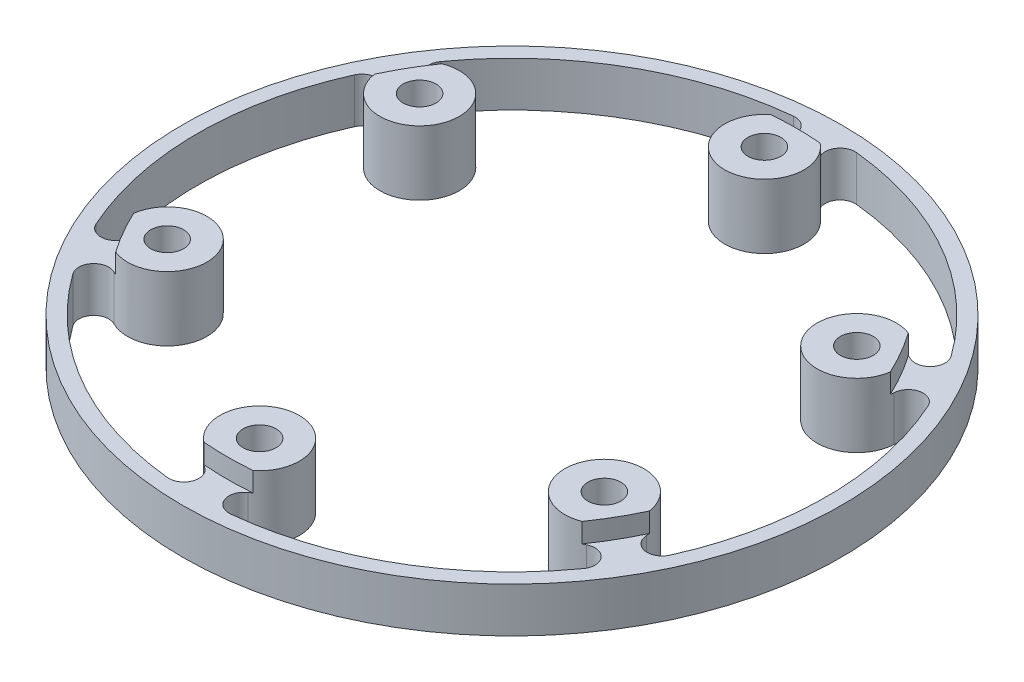
from build123d import *

# Parameters (mm, degrees)
SKETCH1_R             = 22
BASE_SHAPE_DEPTH      = 4.3
BASE_CUT_REACH        = 33.408
SKETCH4_R             = 2
MILLING_FILLETS_R     = 1
MIDDLE_START          = -1.3
SKETCH5_R             = 22
SKETCH5_R_2           = 19
MIDDLE_SLOT_CUT_DEPTH = 1.3
M2_SCREW_HOLES_REACH  = 33.408
SKETCH6_R             = 1.1
REMOVE_INNER_REACH    = 33.408


with BuildPart() as part:
    # Sketch1 → Base shape (new body)
    with BuildSketch(Plane(origin=(0, 0, 0), x_dir=(1, 0, 0), z_dir=(0, 1, 0))):
        Circle(SKETCH1_R)
    extrude(amount=BASE_SHAPE_DEPTH)

    # Sketch4 → Base cut (cut, up to next)
    with BuildSketch(Plane(origin=(0, 4.3, 0), x_dir=(1, 0, 0), z_dir=(0, 1, 0)), mode=Mode.PRIVATE) as base_cut_sk1:
        with BuildLine():
            Line((-0.5, 4.623040125), (-0.5, 14.247597264))
            ThreePointArc((-0.5, 14.247597264), (-2.599217903, 16.333699419), (-1.456663106, 19.063737246))
            ThreePointArc((-1.456663106, 19.063737246), (-1.064005646, 20.23376217), (-2.106664753, 20.894065273))
            ThreePointArc((-2.106664753, 20.894065273), (-10.500000081, 18.186533433), (-17.041459047, 12.271457678))
            ThreePointArc((-17.041459047, 12.271457678), (-16.990949169, 11.038336932), (-15.781349192, 10.793375879))
            ThreePointArc((-15.781349192, 10.793375879), (-12.845789682, 10.417838443), (-12.088781174, 7.556811334))
            Line((-12.088781174, 7.556811334), (-3.753670191, 2.744532765))
            ThreePointArc((-3.753670191, 2.744532765), (-2.325, 4.027018128), (-0.5, 4.623040125))
        make_face()
    base_cut_tool1 = extrude(base_cut_sk1.sketch, amount=-BASE_CUT_REACH, mode=Mode.PRIVATE) & part.part
    # Sketch4 → Base cut (cut, up to next)
    with BuildSketch(Plane(origin=(0, 4.3, 0), x_dir=(1, 0, 0), z_dir=(0, 1, 0)), mode=Mode.PRIVATE) as base_cut_sk2:
        with BuildLine():
            Line((0.5, 14.247597264), (0.5, 4.623040125))
            ThreePointArc((0.5, 4.623040125), (2.325, 4.027018128), (3.753670191, 2.744532765))
            Line((3.753670191, 2.744532765), (12.088781174, 7.556811334))
            ThreePointArc((12.088781174, 7.556811334), (12.845789714, 10.417838471), (15.781349267, 10.793375841))
            ThreePointArc((15.781349267, 10.793375841), (16.990949176, 11.03833694), (17.041459084, 12.271457627))
            ThreePointArc((17.041459084, 12.271457627), (10.500000121, 18.186533409), (2.106664783, 20.89406527))
            ThreePointArc((2.106664783, 20.89406527), (1.064005647, 20.233762173), (1.456663125, 19.063737234))
            ThreePointArc((1.456663125, 19.063737234), (2.599217901, 16.333699407), (0.5, 14.247597264))
        make_face()
    base_cut_tool2 = extrude(base_cut_sk2.sketch, amount=-BASE_CUT_REACH, mode=Mode.PRIVATE) & part.part
    # Sketch4 → Base cut (cut, up to next)
    with BuildSketch(Plane(origin=(0, 4.3, 0), x_dir=(1, 0, 0), z_dir=(0, 1, 0)), mode=Mode.PRIVATE) as base_cut_sk3:
        with BuildLine():
            ThreePointArc((-4.253670191, -1.878507361), (-4.65, 0), (-4.253670191, 1.878507361))
            Line((-4.253670191, 1.878507361), (-12.588781174, 6.69078593))
            ThreePointArc((-12.588781174, 6.69078593), (-15.445007591, 5.915860977), (-17.2380123, 8.27036138))
            ThreePointArc((-17.2380123, 8.27036138), (-18.054954849, 9.19542516), (-19.148123664, 8.622607504))
            ThreePointArc((-19.148123664, 8.622607504), (-21, 0), (-19.148123664, -8.622607504))
            ThreePointArc((-19.148123664, -8.622607504), (-18.054954849, -9.19542516), (-17.2380123, -8.27036138))
            ThreePointArc((-17.2380123, -8.27036138), (-15.445007591, -5.915860977), (-12.588781174, -6.69078593))
            Line((-12.588781174, -6.69078593), (-4.253670191, -1.878507361))
        make_face()
    base_cut_tool3 = extrude(base_cut_sk3.sketch, amount=-BASE_CUT_REACH, mode=Mode.PRIVATE) & part.part
    # Sketch4 → Base cut (cut, up to next)
    with BuildSketch(Plane(origin=(0, 4.3, 0), x_dir=(1, 0, 0), z_dir=(0, 1, 0)), mode=Mode.PRIVATE) as base_cut_sk4:
        with BuildLine():
            Line((12.588781174, 6.69078593), (4.253670191, 1.878507361))
            ThreePointArc((4.253670191, 1.878507361), (4.65, 0), (4.253670191, -1.878507361))
            Line((4.253670191, -1.878507361), (12.588781174, -6.69078593))
            ThreePointArc((12.588781174, -6.69078593), (15.44500764, -5.915860993), (17.238012306, -8.270361482))
            ThreePointArc((17.238012306, -8.270361482), (18.054954899, -9.19542517), (19.148123664, -8.622607504))
            ThreePointArc((19.148123664, -8.622607504), (21, -5.9e-08), (19.148123712, 8.622607396))
            ThreePointArc((19.148123712, 8.622607396), (18.054954907, 9.195425171), (17.2380123, 8.27036138))
            ThreePointArc((17.2380123, 8.27036138), (15.445007591, 5.915860977), (12.588781174, 6.69078593))
        make_face()
    base_cut_tool4 = extrude(base_cut_sk4.sketch, amount=-BASE_CUT_REACH, mode=Mode.PRIVATE) & part.part
    # Sketch4 → Base cut (cut, up to next)
    with BuildSketch(Plane(origin=(0, 4.3, 0), x_dir=(1, 0, 0), z_dir=(0, 1, 0)), mode=Mode.PRIVATE) as base_cut_sk5:
        with BuildLine():
            ThreePointArc((-0.5, -4.623040125), (-2.325, -4.027018128), (-3.753670191, -2.744532765))
            Line((-3.753670191, -2.744532765), (-12.088781174, -7.556811334))
            ThreePointArc((-12.088781174, -7.556811334), (-12.845789662, -10.417838426), (-15.781349145, -10.793375902))
            ThreePointArc((-15.781349145, -10.793375902), (-16.99094917, -11.038336934), (-17.041459014, -12.271457724))
            ThreePointArc((-17.041459014, -12.271457724), (-10.500000007, -18.186533475), (-2.10666464, -20.894065284))
            ThreePointArc((-2.10666464, -20.894065284), (-1.064005631, -20.233762127), (-1.456663086, -19.063737259))
            ThreePointArc((-1.456663086, -19.063737259), (-2.599217906, -16.33369943), (-0.5, -14.247597264))
            Line((-0.5, -14.247597264), (-0.5, -4.623040125))
        make_face()
    base_cut_tool5 = extrude(base_cut_sk5.sketch, amount=-BASE_CUT_REACH, mode=Mode.PRIVATE) & part.part
    # Sketch4 → Base cut (cut, up to next)
    with BuildSketch(Plane(origin=(0, 4.3, 0), x_dir=(1, 0, 0), z_dir=(0, 1, 0)), mode=Mode.PRIVATE) as base_cut_sk6:
        with BuildLine():
            Line((12.088781174, -7.556811334), (3.753670191, -2.744532765))
            ThreePointArc((3.753670191, -2.744532765), (2.325, -4.027018128), (0.5, -4.623040125))
            Line((0.5, -4.623040125), (0.5, -14.247597264))
            ThreePointArc((0.5, -14.247597264), (2.599217906, -16.33369943), (1.456663086, -19.063737259))
            ThreePointArc((1.456663086, -19.063737259), (1.064005629, -20.23376212), (2.106664626, -20.894065285))
            ThreePointArc((2.106664626, -20.894065285), (10.500000013, -18.186533472), (17.04145903, -12.271457701))
            ThreePointArc((17.04145903, -12.271457701), (16.990949199, -11.038336967), (15.781349249, -10.79337585))
            ThreePointArc((15.781349249, -10.79337585), (12.845789706, -10.417838464), (12.088781174, -7.556811334))
        make_face()
    base_cut_tool6 = extrude(base_cut_sk6.sketch, amount=-BASE_CUT_REACH, mode=Mode.PRIVATE) & part.part
    # Sketch4 → Base cut (cut, up to next)
    with BuildSketch(Plane(origin=(0, 4.3, 0), x_dir=(1, 0, 0), z_dir=(0, 1, 0)), mode=Mode.PRIVATE) as base_cut_sk7:
        Circle(SKETCH4_R)
    base_cut_tool7 = extrude(base_cut_sk7.sketch, amount=-BASE_CUT_REACH, mode=Mode.PRIVATE) & part.part
    add(base_cut_tool1.solids().sort_by_distance((-6.983603, 4.3, -12.095955))[0], mode=Mode.SUBTRACT)
    add(base_cut_tool2.solids().sort_by_distance((6.983603, 4.3, -12.095955))[0], mode=Mode.SUBTRACT)
    add(base_cut_tool3.solids().sort_by_distance((-13.967206, 4.3, 0))[0], mode=Mode.SUBTRACT)
    add(base_cut_tool4.solids().sort_by_distance((13.967206, 4.3, 0))[0], mode=Mode.SUBTRACT)
    add(base_cut_tool5.solids().sort_by_distance((-6.983603, 4.3, 12.095955))[0], mode=Mode.SUBTRACT)
    add(base_cut_tool6.solids().sort_by_distance((6.983603, 4.3, 12.095955))[0], mode=Mode.SUBTRACT)
    add(base_cut_tool7.solids().sort_by_distance((0, 4.3, 0))[0], mode=Mode.SUBTRACT)

    # Milling fillets
    milling_fillets_edges = [part.edges().sort_by_distance(p)[0] for p in [
        (12.088781174, 2.15, 7.556811334),
        (0.5, 2.15, 4.623040125),
        (12.588781174, 2.15, -6.69078593),
        (-0.5, 2.15, -4.623040125),
        (12.088781174, 2.15, -7.556811334),
        (0.5, 2.15, -4.623040125),
        (4.253670191, 2.15, 1.878507361),
        (0.5, 2.15, -14.247597264),
        (-12.088781174, 2.15, 7.556811334),
        (0.5, 2.15, 14.247597264),
        (3.753670191, 2.15, 2.744532765),
        (-0.5, 2.15, 4.623040125),
        (-0.5, 2.15, -14.247597264),
        (-0.5, 2.15, 14.247597264),
        (12.588781174, 2.15, 6.69078593),
        (3.753670191, 2.15, -2.744532765),
        (-4.253670191, 2.15, 1.878507361),
        (-12.588781174, 2.15, 6.69078593),
        (-3.753670191, 2.15, -2.744532765),
        (-12.088781174, 2.15, -7.556811334),
        (-12.588781174, 2.15, -6.69078593),
        (-4.253670191, 2.15, -1.878507361),
        (4.253670191, 2.15, -1.878507361),
        (-3.753670191, 2.15, 2.744532765),
    ]]
    fillet(milling_fillets_edges, radius=MILLING_FILLETS_R)

    # Sketch5 → Middle slot cut (cut)
    with BuildSketch(Plane(origin=(0, 4.3, 0), x_dir=(1, 0, 0), z_dir=(0, 1, 0)).offset(MIDDLE_START)):
        Circle(SKETCH5_R)
        Circle(SKETCH5_R_2, mode=Mode.SUBTRACT)
    extrude(amount=MIDDLE_SLOT_CUT_DEPTH, mode=Mode.SUBTRACT)

    # Sketch6 → M2 screw holes (cut, up to next)
    with BuildSketch(Plane(origin=(0, 4.3, 0), x_dir=(1, 0, 0), z_dir=(0, 1, 0)), mode=Mode.PRIVATE) as m2_screw_holes_sk1:
        with Locations((0, 16.85)):
            Circle(SKETCH6_R)
    m2_screw_holes_tool1 = extrude(m2_screw_holes_sk1.sketch, amount=-M2_SCREW_HOLES_REACH, mode=Mode.PRIVATE) & part.part
    # Sketch6 → M2 screw holes (cut, up to next)
    with BuildSketch(Plane(origin=(0, 4.3, 0), x_dir=(1, 0, 0), z_dir=(0, 1, 0)), mode=Mode.PRIVATE) as m2_screw_holes_sk2:
        with Locations((14.592528054, 8.425)):
            Circle(SKETCH6_R)
    m2_screw_holes_tool2 = extrude(m2_screw_holes_sk2.sketch, amount=-M2_SCREW_HOLES_REACH, mode=Mode.PRIVATE) & part.part
    # Sketch6 → M2 screw holes (cut, up to next)
    with BuildSketch(Plane(origin=(0, 4.3, 0), x_dir=(1, 0, 0), z_dir=(0, 1, 0)), mode=Mode.PRIVATE) as m2_screw_holes_sk3:
        with Locations((14.592528054, -8.425)):
            Circle(SKETCH6_R)
    m2_screw_holes_tool3 = extrude(m2_screw_holes_sk3.sketch, amount=-M2_SCREW_HOLES_REACH, mode=Mode.PRIVATE) & part.part
    # Sketch6 → M2 screw holes (cut, up to next)
    with BuildSketch(Plane(origin=(0, 4.3, 0), x_dir=(1, 0, 0), z_dir=(0, 1, 0)), mode=Mode.PRIVATE) as m2_screw_holes_sk4:
        with Locations((0, -16.85)):
            Circle(SKETCH6_R)
    m2_screw_holes_tool4 = extrude(m2_screw_holes_sk4.sketch, amount=-M2_SCREW_HOLES_REACH, mode=Mode.PRIVATE) & part.part
    # Sketch6 → M2 screw holes (cut, up to next)
    with BuildSketch(Plane(origin=(0, 4.3, 0), x_dir=(1, 0, 0), z_dir=(0, 1, 0)), mode=Mode.PRIVATE) as m2_screw_holes_sk5:
        with Locations((-14.592528054, -8.425)):
            Circle(SKETCH6_R)
    m2_screw_holes_tool5 = extrude(m2_screw_holes_sk5.sketch, amount=-M2_SCREW_HOLES_REACH, mode=Mode.PRIVATE) & part.part
    # Sketch6 → M2 screw holes (cut, up to next)
    with BuildSketch(Plane(origin=(0, 4.3, 0), x_dir=(1, 0, 0), z_dir=(0, 1, 0)), mode=Mode.PRIVATE) as m2_screw_holes_sk6:
        with Locations((-14.592528054, 8.425)):
            Circle(SKETCH6_R)
    m2_screw_holes_tool6 = extrude(m2_screw_holes_sk6.sketch, amount=-M2_SCREW_HOLES_REACH, mode=Mode.PRIVATE) & part.part
    add(m2_screw_holes_tool1.solids().sort_by_distance((0, 4.3, -16.85))[0], mode=Mode.SUBTRACT)
    add(m2_screw_holes_tool2.solids().sort_by_distance((14.592528, 4.3, -8.425))[0], mode=Mode.SUBTRACT)
    add(m2_screw_holes_tool3.solids().sort_by_distance((14.592528, 4.3, 8.425))[0], mode=Mode.SUBTRACT)
    add(m2_screw_holes_tool4.solids().sort_by_distance((0, 4.3, 16.85))[0], mode=Mode.SUBTRACT)
    add(m2_screw_holes_tool5.solids().sort_by_distance((-14.592528, 4.3, 8.425))[0], mode=Mode.SUBTRACT)
    add(m2_screw_holes_tool6.solids().sort_by_distance((-14.592528, 4.3, -8.425))[0], mode=Mode.SUBTRACT)

    # Sketch9 → Remove inner (cut, up to next)
    with BuildSketch(Plane(origin=(0, 4.3, 0), x_dir=(1, 0, 0), z_dir=(0, 1, 0)), mode=Mode.PRIVATE) as remove_inner_sk1:
        with BuildLine():
            ThreePointArc((13.044832762, -6.273921367), (12.510822481, -6.460941513), (11.960796803, -6.328218985))
            Line((11.960796803, -6.328218985), (4.967454292, -2.290610804))
            ThreePointArc((4.967454292, -2.290610804), (4.544902316, -1.810458242), (4.499763267, -1.172446391))
            ThreePointArc((4.499763267, -1.172446391), (4.65, 0), (4.499763267, 1.172446391))
            ThreePointArc((4.499763267, 1.172446391), (4.544902316, 1.810458242), (4.967454292, 2.290610804))
            Line((4.967454292, 2.290610804), (11.960796803, 6.328218985))
            ThreePointArc((11.960796803, 6.328218985), (12.510822481, 6.460941513), (13.044832762, 6.273921367))
            ThreePointArc((13.044832762, 6.273921367), (12.297560734, 7.1), (11.955791666, 8.160195877))
            ThreePointArc((11.955791666, 8.160195877), (11.850750723, 7.604219334), (11.460796803, 7.194244389))
            Line((11.460796803, 7.194244389), (4.467454292, 3.156636207))
            ThreePointArc((4.467454292, 3.156636207), (3.840353988, 3.030771742), (3.265249993, 3.310686105))
            ThreePointArc((3.265249993, 3.310686105), (2.325, 4.027018128), (1.234513274, 4.483132496))
            ThreePointArc((1.234513274, 4.483132496), (0.704548328, 4.841229984), (0.5, 5.447247011))
            Line((0.5, 5.447247011), (0.5, 13.522463374))
            ThreePointArc((0.5, 13.522463374), (0.660071758, 14.065160847), (1.089041096, 14.434117244))
            ThreePointArc((1.089041096, 14.434117244), (0, 14.2), (-1.089041096, 14.434117244))
            ThreePointArc((-1.089041096, 14.434117244), (-0.660071758, 14.065160847), (-0.5, 13.522463374))
            Line((-0.5, 13.522463374), (-0.5, 5.447247011))
            ThreePointArc((-0.5, 5.447247011), (-0.704548328, 4.841229984), (-1.234513274, 4.483132496))
            ThreePointArc((-1.234513274, 4.483132496), (-2.325, 4.027018128), (-3.265249993, 3.310686105))
            ThreePointArc((-3.265249993, 3.310686105), (-3.840353988, 3.030771742), (-4.467454292, 3.156636207))
            Line((-4.467454292, 3.156636207), (-11.460796803, 7.194244389))
            ThreePointArc((-11.460796803, 7.194244389), (-11.850750723, 7.604219334), (-11.955791666, 8.160195877))
            ThreePointArc((-11.955791666, 8.160195877), (-12.297560734, 7.1), (-13.044832762, 6.273921367))
            ThreePointArc((-13.044832762, 6.273921367), (-12.510822481, 6.460941513), (-11.960796803, 6.328218985))
            Line((-11.960796803, 6.328218985), (-4.967454292, 2.290610804))
            ThreePointArc((-4.967454292, 2.290610804), (-4.544902316, 1.810458242), (-4.499763267, 1.172446391))
            ThreePointArc((-4.499763267, 1.172446391), (-4.65, 0), (-4.499763267, -1.172446391))
            ThreePointArc((-4.499763267, -1.172446391), (-4.544902316, -1.810458242), (-4.967454292, -2.290610804))
            Line((-4.967454292, -2.290610804), (-11.960796803, -6.328218985))
            ThreePointArc((-11.960796803, -6.328218985), (-12.510822481, -6.460941513), (-13.044832762, -6.273921367))
            ThreePointArc((-13.044832762, -6.273921367), (-12.297560734, -7.1), (-11.955791666, -8.160195877))
            ThreePointArc((-11.955791666, -8.160195877), (-11.850750723, -7.604219334), (-11.460796803, -7.194244389))
            Line((-11.460796803, -7.194244389), (-4.467454292, -3.156636207))
            ThreePointArc((-4.467454292, -3.156636207), (-3.840353988, -3.030771742), (-3.265249993, -3.310686105))
            ThreePointArc((-3.265249993, -3.310686105), (-2.325, -4.027018128), (-1.234513274, -4.483132496))
            ThreePointArc((-1.234513274, -4.483132496), (-0.704548328, -4.841229984), (-0.5, -5.447247011))
            Line((-0.5, -5.447247011), (-0.5, -13.522463374))
            ThreePointArc((-0.5, -13.522463374), (-0.660071758, -14.065160847), (-1.089041096, -14.434117244))
            ThreePointArc((-1.089041096, -14.434117244), (0, -14.2), (1.089041096, -14.434117244))
            ThreePointArc((1.089041096, -14.434117244), (0.660071758, -14.065160847), (0.5, -13.522463374))
            Line((0.5, -13.522463374), (0.5, -5.447247011))
            ThreePointArc((0.5, -5.447247011), (0.704548328, -4.841229984), (1.234513274, -4.483132496))
            ThreePointArc((1.234513274, -4.483132496), (2.325, -4.027018128), (3.265249993, -3.310686105))
            ThreePointArc((3.265249993, -3.310686105), (3.840353988, -3.030771742), (4.467454292, -3.156636207))
            Line((4.467454292, -3.156636207), (11.460796803, -7.194244389))
            ThreePointArc((11.460796803, -7.194244389), (11.850750723, -7.604219334), (11.955791666, -8.160195877))
            ThreePointArc((11.955791666, -8.160195877), (12.297560734, -7.1), (13.044832762, -6.273921367))
        make_face()
    remove_inner_tool1 = extrude(remove_inner_sk1.sketch, amount=-REMOVE_INNER_REACH, mode=Mode.PRIVATE) & part.part
    add(remove_inner_tool1.solids().sort_by_distance((0, 4.3, 0))[0], mode=Mode.SUBTRACT)


solid = part.part
